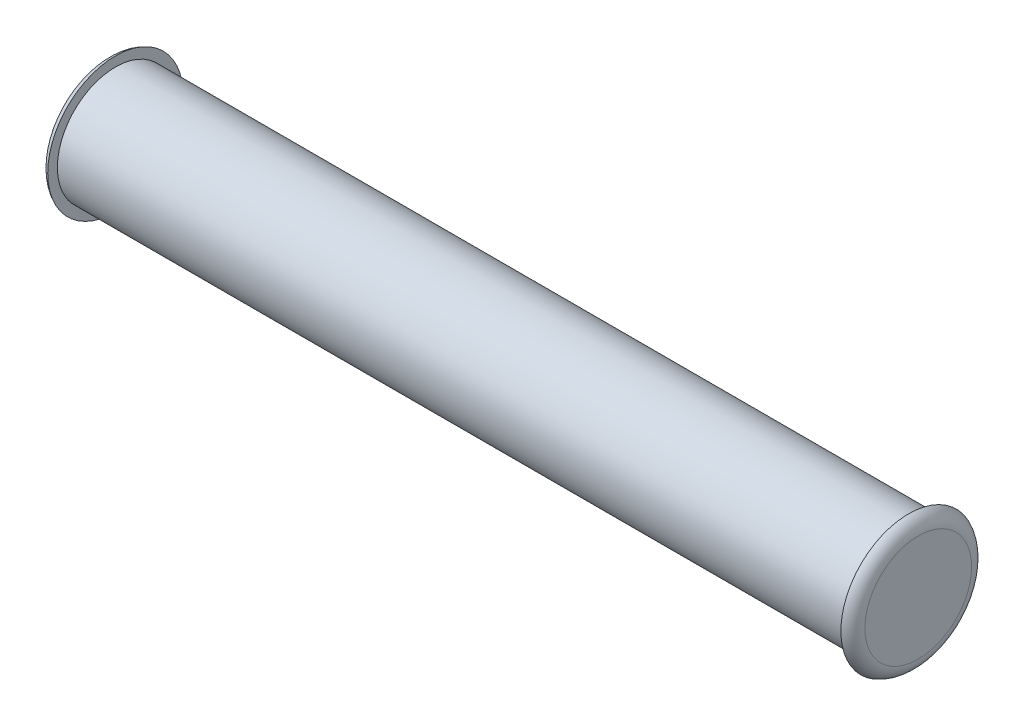
from build123d import *

# Parameters (mm, degrees)
SKETCH1_R      = 0.762
EXTRUDE1_DEPTH = 10.414
SKETCH2_R      = 0.889
EXTRUDE2_DEPTH = 0.127
EXTRUDE3_START = 0.127
SKETCH3_R      = 0.889
EXTRUDE3_DEPTH = 0.127
FILLET1_R      = 0.2032


with BuildPart() as part:
    # Sketch1 → Extrude1 (new body)
    with BuildSketch(Plane(origin=(0, 0, 0), x_dir=(0, 0, -1), z_dir=(1, 0, 0))):
        Circle(SKETCH1_R)
    extrude(amount=EXTRUDE1_DEPTH)

    # Sketch2 → Extrude2 (add)
    with BuildSketch(Plane(origin=(10.414, 0, 0), x_dir=(0, 0, -1), z_dir=(1, 0, 0))):
        Circle(SKETCH2_R)
    extrude(amount=EXTRUDE2_DEPTH)

    # Sketch3 → Extrude3 (add)
    with BuildSketch(Plane.ZY.offset(EXTRUDE3_START)):
        with Locations(Location((0, 0, 0), (0, 0, 180))):
            Circle(SKETCH3_R)
    extrude(amount=-EXTRUDE3_DEPTH)

    # Fillet1
    # the kernel refuses this fillet: 0.2032 mm, written as the material it takes off along each edge
    with BuildSketch(Plane(origin=(10.541, 0, 0), x_dir=(0, 0, -1), z_dir=(0, -1, 0))) as fillet1_piece_1:
        with BuildLine():
            CenterArc((0.700628558, -0.2032), FILLET1_R, 22.024312837, 67.975687163)
            Line((0.700628558, 0), (0.700628558, 0.004064))
            Line((0.700628558, 0.004064), (0.889, 0.004064))
            Line((0.889, 0.004064), (0.893064, 0))
            ThreePointArc((0.893064, 0), (0.893064, -0.0635), (0.892767429, -0.125476))
            Line((0.892767429, -0.125476), (0.889, -0.127))
        make_face()
    revolve(axis=Axis((10.541, 0, 0), (1, 0, 0)), mode=Mode.SUBTRACT)
    with BuildSketch(Plane(origin=(-0.127, 0, 0), x_dir=(0, 0, -1), z_dir=(0, 1, 0))) as fillet1_piece_2:
        with BuildLine():
            CenterArc((0.700628558, -0.2032), FILLET1_R, 22.024312837, 67.975687163)
            Line((0.700628558, 0), (0.700628558, 0.004064))
            Line((0.700628558, 0.004064), (0.889, 0.004064))
            Line((0.889, 0.004064), (0.893064, 0))
            ThreePointArc((0.893064, 0), (0.893064, -0.0635), (0.892767429, -0.125476))
            Line((0.892767429, -0.125476), (0.889, -0.127))
        make_face()
    revolve(axis=Axis((-0.127, 0, 0), (-1, 0, 0)), mode=Mode.SUBTRACT)


solid = part.part
